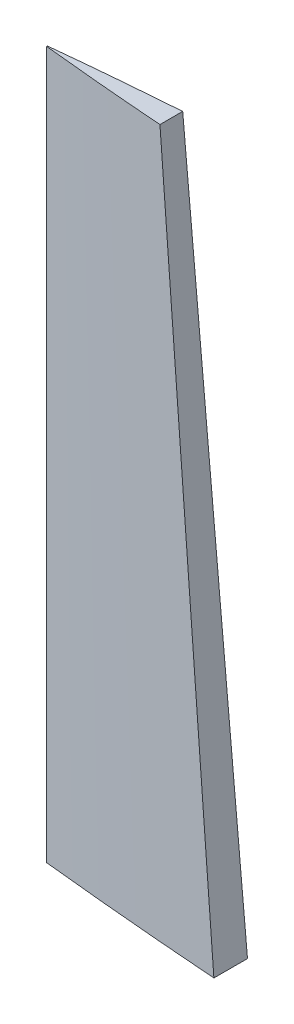
from build123d import *


with BuildPart() as part:
    # Sketch1 → Loft1 section 0
    with BuildSketch(Plane(origin=(0, 22, 0), x_dir=(1, 0, 0), z_dir=(0, 1, 0))):
        with BuildLine():
            Line((-111.236292905, 4.123664027), (-111.236292905, -4.123664027))
            add(Edge.make_bspline(
                [(-111.236292905, -4.123664027), (-111.404833261, -4.111771733), (-113.907527567, -3.935180339), (-118.605724959, -3.571338351), (-125.170444891, -3.047231598), (-131.253323629, -2.53261196), (-136.788024564, -2.043408264), (-141.713828162, -1.58980905), (-145.976784367, -1.182979706), (-149.530190027, -0.833233139), (-152.335128713, -0.550049233), (-154.360880593, -0.341452681), (-155.58527548, -0.213727229), (-156.1319488, -0.156260066), (-156.269, -0.141853027)],
                knots=[0, 0, 0, 0, 0.011211572, 0.166483201, 0.31268616, 0.448210553, 0.571562716, 0.681381362, 0.776452467, 0.855722863, 0.918312437, 0.963524724, 0.990855635, 1, 1, 1, 1], degree=3))
            Line((-156.269, -0.141853027), (-156.269, 0.141853027))
            add(Edge.make_bspline(
                [(-111.236292905, 4.123664027), (-111.404833261, 4.111771733), (-113.907527567, 3.935180339), (-118.605724959, 3.571338351), (-125.170444891, 3.047231598), (-131.253323629, 2.53261196), (-136.788024564, 2.043408264), (-141.713828162, 1.58980905), (-145.976784367, 1.182979706), (-149.530190027, 0.833233139), (-152.335128713, 0.550049233), (-154.360880593, 0.341452681), (-155.58527548, 0.213727229), (-156.1319488, 0.156260066), (-156.269, 0.141853027)],
                knots=[0, 0, 0, 0, 0.011211572, 0.166483201, 0.31268616, 0.448210553, 0.571562716, 0.681381362, 0.776452467, 0.855722863, 0.918312437, 0.963524724, 0.990855635, 1, 1, 1, 1], degree=3))
        make_face()
    # Sketch2 → Loft1 section 1
    with BuildSketch(Plane(origin=(0, 195.337, 0), x_dir=(1, 0, 0), z_dir=(0, 1, 0))):
        with BuildLine():
            Line((-125.796545, 2.790375587), (-125.796545, -2.790375587))
            add(Edge.make_bspline(
                [(-125.796545, -2.790375587), (-125.910591851, -2.782328383), (-127.604099626, -2.662833605), (-130.783246913, -2.416631249), (-135.225421183, -2.061981918), (-139.341546118, -1.713752269), (-143.086733474, -1.382720924), (-146.419895927, -1.075782201), (-149.304526888, -0.800491425), (-151.709023554, -0.563827071), (-153.607052196, -0.372203929), (-154.977825507, -0.231052098), (-155.806341501, -0.144623625), (-156.176261038, -0.105737099), (-156.269, -0.095988233)],
                knots=[0, 0, 0, 0, 0.011211572, 0.166483201, 0.31268616, 0.448210553, 0.571562716, 0.681381362, 0.776452467, 0.855722863, 0.918312437, 0.963524724, 0.990855635, 1, 1, 1, 1], degree=3))
            Line((-156.269, -0.095988233), (-156.269, 0.095988233))
            add(Edge.make_bspline(
                [(-125.796545, 2.790375587), (-125.910591851, 2.782328383), (-127.604099626, 2.662833605), (-130.783246913, 2.416631249), (-135.225421183, 2.061981918), (-139.341546118, 1.713752269), (-143.086733474, 1.382720924), (-146.419895927, 1.075782201), (-149.304526888, 0.800491425), (-151.709023554, 0.563827071), (-153.607052196, 0.372203929), (-154.977825507, 0.231052098), (-155.806341501, 0.144623625), (-156.176261038, 0.105737099), (-156.269, 0.095988233)],
                knots=[0, 0, 0, 0, 0.011211572, 0.166483201, 0.31268616, 0.448210553, 0.571562716, 0.681381362, 0.776452467, 0.855722863, 0.918312437, 0.963524724, 0.990855635, 1, 1, 1, 1], degree=3))
        make_face()
    loft()


solid = part.part
